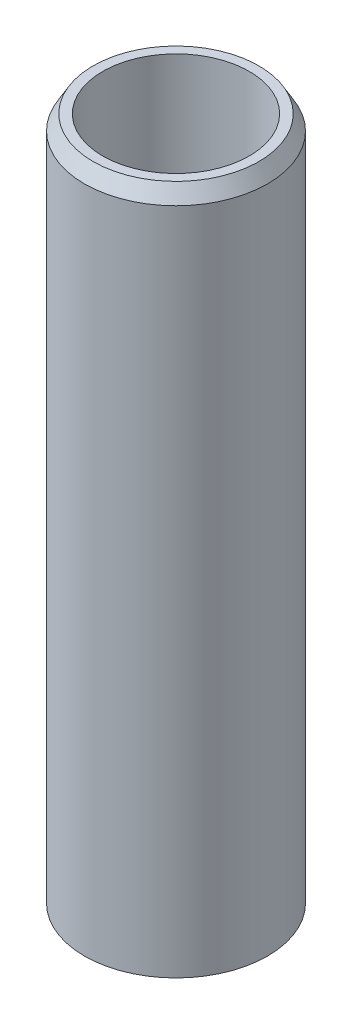
from build123d import *
from OCP.BRepFilletAPI import BRepFilletAPI_MakeChamfer

# Parameters (mm, degrees)
SKETCH1_R           = 25
BOSS_EXTRUDE1_DEPTH = 189.021684952
SKETCH2_R           = 20.012732986
CUT_EXTRUDE1_DEPTH  = 193.299759183
CHAMFER1_SIZE       = 4.093766705
CHAMFER1_SIZE2      = 2.363537309


with BuildPart() as part:
    # Sketch1 → Boss-Extrude1 (new body)
    with BuildSketch(Plane(origin=(0, 0, 0), x_dir=(1, 0, 0), z_dir=(0, 1, 0))):
        Circle(SKETCH1_R)
    extrude(amount=BOSS_EXTRUDE1_DEPTH)

    # Sketch2 → Cut-Extrude1 (cut, through all)
    with BuildSketch(Plane(origin=(0, 0, 0), x_dir=(1, 0, 0), z_dir=(0, 1, 0))):
        Circle(SKETCH2_R)
    extrude(amount=CUT_EXTRUDE1_DEPTH, mode=Mode.SUBTRACT)

    # Chamfer1: one chamfer whose edges measure the first distance from different faces: ONE call of the kernel's chamfer builder (chamfer() names one face for all edges)
    chamfer1_edges_1 = [part.edges().sort_by_distance(p)[0] for p in [
        (-25, 189.021684952, 0),
    ]]
    chamfer1_side_1 = [part.faces().sort_by_distance(p)[0] for p in [
        (-25, 94.510842476, 0),
    ]]
    chamfer1_edges_2 = [part.edges().sort_by_distance(p)[0] for p in [
        (-25, 0, 0),
    ]]
    chamfer1_side_2 = [part.faces().sort_by_distance(p)[0] for p in [
        (-24.292893219, 0, 0),
    ]]
    chamfer1 = BRepFilletAPI_MakeChamfer(part.part.solid().wrapped)
    for e in chamfer1_edges_1:
        chamfer1.Add(CHAMFER1_SIZE, CHAMFER1_SIZE2, e.wrapped, chamfer1_side_1[0].wrapped)  # the first distance lies on this face
    for e in chamfer1_edges_2:
        chamfer1.Add(CHAMFER1_SIZE, CHAMFER1_SIZE2, e.wrapped, chamfer1_side_2[0].wrapped)  # the first distance lies on this face
    add(Compound.cast(chamfer1.Shape()), mode=Mode.REPLACE)


solid = part.part
